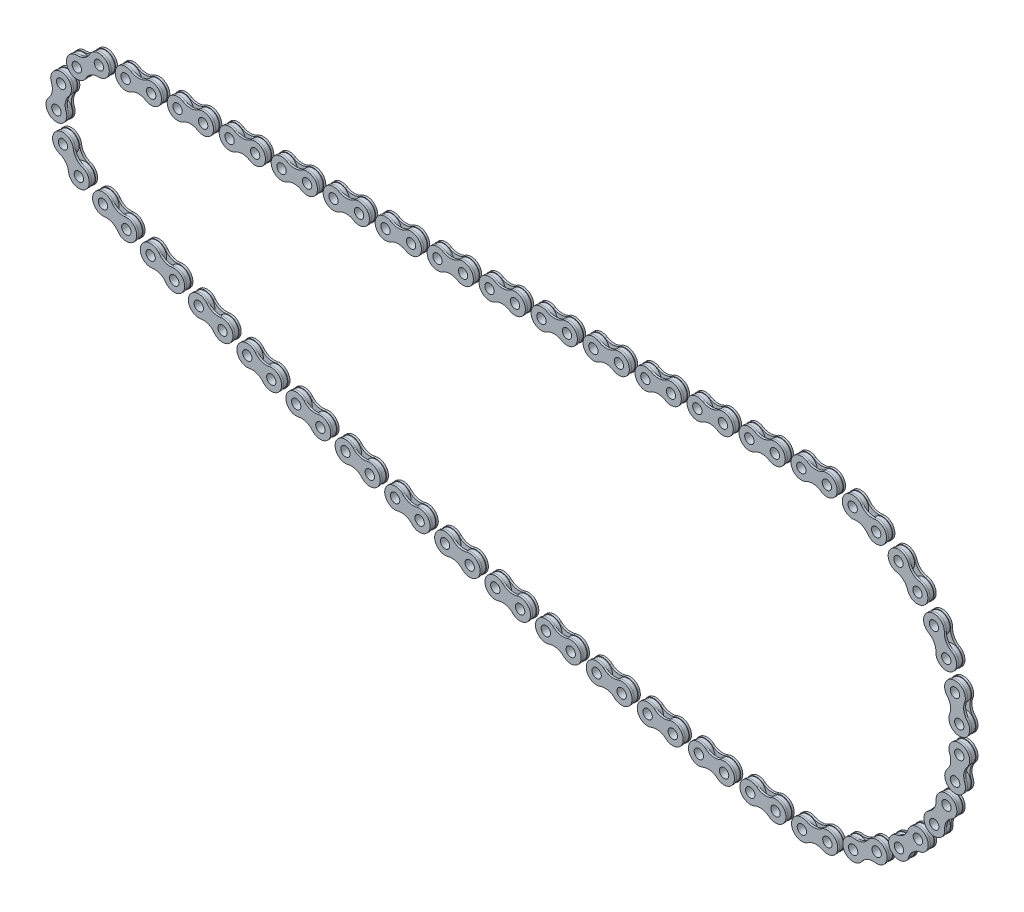
from build123d import *

# Parameters (mm, degrees)
SKETCH1_R             = 4.75
SKETCH1_R_2           = 2.25
BOSS_EXTRUDE1_DEPTH   = 1
BOSS_EXTRUDE1_2_DEPTH = 1
SKETCH3_R             = 2.25
BOSS_EXTRUDE2_DEPTH   = 1
CRVPATTERN1_5_ANGLE   = 3.8901012
CRVPATTERN1_6_ANGLE   = 23.0027709
CRVPATTERN1_7_ANGLE   = 42.1154406
CRVPATTERN1_8_ANGLE   = 61.2281103
CRVPATTERN1_9_ANGLE   = 80.34078
CRVPATTERN1_10_ANGLE  = 99.4534497
CRVPATTERN1_11_ANGLE  = 118.5661194
CRVPATTERN1_12_ANGLE  = 137.6787891
CRVPATTERN1_13_ANGLE  = 156.7914588
CRVPATTERN1_14_ANGLE  = 175.9041285
CRVPATTERN1_15_ANGLE  = 172.3357403
CRVPATTERN1_16_ANGLE  = 171.095109
CRVPATTERN1_17_ANGLE  = 169.8544777
CRVPATTERN1_18_ANGLE  = 168.6138464
CRVPATTERN1_19_ANGLE  = 167.3732151
CRVPATTERN1_20_ANGLE  = 166.1325838
CRVPATTERN1_21_ANGLE  = 164.8919525
CRVPATTERN1_22_ANGLE  = 163.6513212
CRVPATTERN1_23_ANGLE  = 162.4106898
CRVPATTERN1_24_ANGLE  = 161.1700585
CRVPATTERN1_25_ANGLE  = 159.9294272
CRVPATTERN1_26_ANGLE  = 158.6887959
CRVPATTERN1_27_ANGLE  = 157.4481646
CRVPATTERN1_28_ANGLE  = 156.2075333
CRVPATTERN1_29_ANGLE  = 128.6116148
CRVPATTERN1_30_ANGLE  = 79.3521569
CRVPATTERN1_31_ANGLE  = 30.0926989


with BuildPart() as part:
    # Sketch1 → Boss-Extrude1 (new, symmetric)
    with BuildSketch(Plane.XY):
        with Locations((-6.15, 0)):
            Circle(SKETCH1_R)
        with Locations((-6.15, 0)):
            Circle(SKETCH1_R_2, mode=Mode.SUBTRACT)
    extrude(amount=BOSS_EXTRUDE1_DEPTH, both=True)



with BuildPart() as body_2:
    # Sketch1 → Boss-Extrude1 2 (new, symmetric)
    with BuildSketch(Plane.XY):
        with Locations(Location((6.15, 0, 0), (0, 0, 180))):
            Circle(SKETCH1_R)
        with Locations((6.15, 0)):
            Circle(SKETCH1_R_2, mode=Mode.SUBTRACT)
    extrude(amount=BOSS_EXTRUDE1_2_DEPTH, both=True)


with BuildPart() as part_1:
    add(part.part)

    add(body_2.part)  # Boss-Extrude2 merges body 2
    # Sketch3 → Boss-Extrude2 (add)
    with BuildSketch(Plane.XY.offset(1)):
        with BuildLine():
            ThreePointArc((-3.526184157, 4.256241349), (-11.15, 0), (-3.526184157, -4.256241349))
            ThreePointArc((-3.526184157, -4.256241349), (0, -3.256693314), (3.526184157, -4.256241349))
            ThreePointArc((3.526184157, -4.256241349), (11.15, 0), (3.526184157, 4.256241349))
            ThreePointArc((3.526184157, 4.256241349), (0, 3.256693314), (-3.526184157, 4.256241349))
        make_face()
        with Locations((-6.15, 0)):
            Circle(SKETCH3_R, mode=Mode.SUBTRACT)
        with Locations((6.15, 0)):
            Circle(SKETCH3_R, mode=Mode.SUBTRACT)
    boss_extrude2 = extrude(amount=BOSS_EXTRUDE2_DEPTH)

    # Mirror1: Boss-Extrude2 across plane
    add(boss_extrude2.mirror(Plane.XY))


with BuildPart() as body_2_2:
    # CrvPattern1: read off the stored shape, not the designer's step
    # CrvPattern1: copy of part
    add(part_1.part.moved(Location((25.0184261, 0, 0))))


with BuildPart() as body_3:
    # CrvPattern1 2: copy of part
    add(part_1.part.moved(Location((50.0368522, 0, 0))))


with BuildPart() as body_4:
    # CrvPattern1 3: copy of part
    add(part_1.part.moved(Location((75.0552784, 0, 0))))


with BuildPart() as body_5:
    # CrvPattern1 4: copy of part
    add(part_1.part.moved(Location((100.0737045, 0, 0))))


with BuildPart() as body_6:
    # CrvPattern1 5: copy of part
    add(part_1.part.moved(Location((124.811741, 8.3139498, 0))).rotate(Axis((0, 0, 0), (0, 0, -1)), CRVPATTERN1_5_ANGLE))


with BuildPart() as body_7:
    # CrvPattern1 6: copy of part
    add(part_1.part.moved(Location((139.7664881, 52.8566308, 0))).rotate(Axis((0, 0, 0), (0, 0, -1)), CRVPATTERN1_6_ANGLE))


with BuildPart() as body_8:
    # CrvPattern1 7: copy of part
    add(part_1.part.moved(Location((139.3124081, 99.8405504, 0))).rotate(Axis((0, 0, 0), (0, 0, -1)), CRVPATTERN1_7_ANGLE))


with BuildPart() as body_9:
    # CrvPattern1 8: copy of part
    add(part_1.part.moved(Location((123.499562, 144.0858754, 0))).rotate(Axis((0, 0, 0), (0, 0, -1)), CRVPATTERN1_8_ANGLE))


with BuildPart() as body_10:
    # CrvPattern1 9: copy of part
    add(part_1.part.moved(Location((94.0712676, 180.7146944, 0))).rotate(Axis((0, 0, 0), (0, 0, -1)), CRVPATTERN1_9_ANGLE))


with BuildPart() as body_11:
    # CrvPattern1 10: copy of part
    add(part_1.part.moved(Location((54.2719042, 205.6887922, 0))).rotate(Axis((0, 0, 0), (0, 0, -1)), CRVPATTERN1_10_ANGLE))


with BuildPart() as body_12:
    # CrvPattern1 11: copy of part
    add(part_1.part.moved(Location((8.4892296, 216.2548512, 0))).rotate(Axis((0, 0, 0), (0, 0, -1)), CRVPATTERN1_11_ANGLE))


with BuildPart() as body_13:
    # CrvPattern1 12: copy of part
    add(part_1.part.moved(Location((-38.2293565, 211.2479956, 0))).rotate(Axis((0, 0, 0), (0, 0, -1)), CRVPATTERN1_12_ANGLE))


with BuildPart() as body_14:
    # CrvPattern1 13: copy of part
    add(part_1.part.moved(Location((-80.7332732, 191.220216, 0))).rotate(Axis((0, 0, 0), (0, 0, -1)), CRVPATTERN1_13_ANGLE))


with BuildPart() as body_15:
    # CrvPattern1 14: copy of part
    add(part_1.part.moved(Location((-114.3365939, 158.3795137, 0))).rotate(Axis((0, 0, 0), (0, 0, -1)), CRVPATTERN1_14_ANGLE))


with BuildPart() as body_16:
    # CrvPattern1 15: copy of part
    add(part_1.part.moved(Location((-119.306267, 133.3687015, 0))).rotate(Axis((0, 0, 0), (0, 0, 1)), CRVPATTERN1_15_ANGLE))


with BuildPart() as body_17:
    # CrvPattern1 16: copy of part
    add(part_1.part.moved(Location((-97.1494485, 131.0251412, 0))).rotate(Axis((0, 0, 0), (0, 0, 1)), CRVPATTERN1_16_ANGLE))


with BuildPart() as body_18:
    # CrvPattern1 17: copy of part
    add(part_1.part.moved(Location((-74.9470826, 129.1618566, 0))).rotate(Axis((0, 0, 0), (0, 0, 1)), CRVPATTERN1_17_ANGLE))


with BuildPart() as body_19:
    # CrvPattern1 18: copy of part
    add(part_1.part.moved(Location((-52.7095786, 127.7797213, 0))).rotate(Axis((0, 0, 0), (0, 0, 1)), CRVPATTERN1_18_ANGLE))


with BuildPart() as body_20:
    # CrvPattern1 19: copy of part
    add(part_1.part.moved(Location((-30.4473623, 126.8793833, 0))).rotate(Axis((0, 0, 0), (0, 0, 1)), CRVPATTERN1_19_ANGLE))


with BuildPart() as body_21:
    # CrvPattern1 20: copy of part
    add(part_1.part.moved(Location((-8.1708712, 126.4612647, 0))).rotate(Axis((0, 0, 0), (0, 0, 1)), CRVPATTERN1_20_ANGLE))


with BuildPart() as body_22:
    # CrvPattern1 21: copy of part
    add(part_1.part.moved(Location((14.1094508, 126.5255615, 0))).rotate(Axis((0, 0, 0), (0, 0, 1)), CRVPATTERN1_21_ANGLE))


with BuildPart() as body_23:
    # CrvPattern1 22: copy of part
    add(part_1.part.moved(Location((36.3831578, 127.0722437, 0))).rotate(Axis((0, 0, 0), (0, 0, 1)), CRVPATTERN1_22_ANGLE))


with BuildPart() as body_24:
    # CrvPattern1 23: copy of part
    add(part_1.part.moved(Location((58.6398069, 128.1010548, 0))).rotate(Axis((0, 0, 0), (0, 0, 1)), CRVPATTERN1_23_ANGLE))


with BuildPart() as body_25:
    # CrvPattern1 24: copy of part
    add(part_1.part.moved(Location((80.8689634, 129.6115126, 0))).rotate(Axis((0, 0, 0), (0, 0, 1)), CRVPATTERN1_24_ANGLE))


with BuildPart() as body_26:
    # CrvPattern1 25: copy of part
    add(part_1.part.moved(Location((103.0602054, 131.6029088, 0))).rotate(Axis((0, 0, 0), (0, 0, 1)), CRVPATTERN1_25_ANGLE))


with BuildPart() as body_27:
    # CrvPattern1 26: copy of part
    add(part_1.part.moved(Location((125.2031288, 134.0743099, 0))).rotate(Axis((0, 0, 0), (0, 0, 1)), CRVPATTERN1_26_ANGLE))


with BuildPart() as body_28:
    # CrvPattern1 27: copy of part
    add(part_1.part.moved(Location((147.2873522, 137.0245572, 0))).rotate(Axis((0, 0, 0), (0, 0, 1)), CRVPATTERN1_27_ANGLE))


with BuildPart() as body_29:
    # CrvPattern1 28: copy of part
    add(part_1.part.moved(Location((169.3025217, 140.4522674, 0))).rotate(Axis((0, 0, 0), (0, 0, 1)), CRVPATTERN1_28_ANGLE))


with BuildPart() as body_30:
    # CrvPattern1 29: copy of part
    add(part_1.part.moved(Location((108.2357996, 211.2600618, 0))).rotate(Axis((0, 0, 0), (0, 0, 1)), CRVPATTERN1_29_ANGLE))


with BuildPart() as body_31:
    # CrvPattern1 30: copy of part
    add(part_1.part.moved(Location((-67.3792732, 229.991289, 0))).rotate(Axis((0, 0, 0), (0, 0, 1)), CRVPATTERN1_30_ANGLE))


with BuildPart() as body_32:
    # CrvPattern1 31: copy of part
    add(part_1.part.moved(Location((-196.1839018, 109.1571864, 0))).rotate(Axis((0, 0, 0), (0, 0, 1)), CRVPATTERN1_31_ANGLE))


with BuildPart() as body_33:
    # CrvPattern1 32: copy of part
    add(part_1.part.moved(Location((-200.147409, 0, 0))))


with BuildPart() as body_34:
    # CrvPattern1 33: copy of part
    add(part_1.part.moved(Location((-175.1289829, 0, 0))))


with BuildPart() as body_35:
    # CrvPattern1 34: copy of part
    add(part_1.part.moved(Location((-150.1105567, 0, 0))))


with BuildPart() as body_36:
    # CrvPattern1 35: copy of part
    add(part_1.part.moved(Location((-125.0921306, 0, 0))))


with BuildPart() as body_37:
    # CrvPattern1 36: copy of part
    add(part_1.part.moved(Location((-100.0737045, 0, 0))))


with BuildPart() as body_38:
    # CrvPattern1 37: copy of part
    add(part_1.part.moved(Location((-75.0552784, 0, 0))))


with BuildPart() as body_39:
    # CrvPattern1 38: copy of part
    add(part_1.part.moved(Location((-50.0368522, 0, 0))))


with BuildPart() as body_40:
    # CrvPattern1 39: copy of part
    add(part_1.part.moved(Location((-25.0184261, 0, 0))))


solid = Compound([part_1.part, body_2_2.part, body_3.part, body_4.part, body_5.part, body_6.part, body_7.part, body_8.part, body_9.part, body_10.part, body_11.part, body_12.part, body_13.part, body_14.part, body_15.part, body_16.part, body_17.part, body_18.part, body_19.part, body_20.part, body_21.part, body_22.part, body_23.part, body_24.part, body_25.part, body_26.part, body_27.part, body_28.part, body_29.part, body_30.part, body_31.part, body_32.part, body_33.part, body_34.part, body_35.part, body_36.part, body_37.part, body_38.part, body_39.part, body_40.part])
